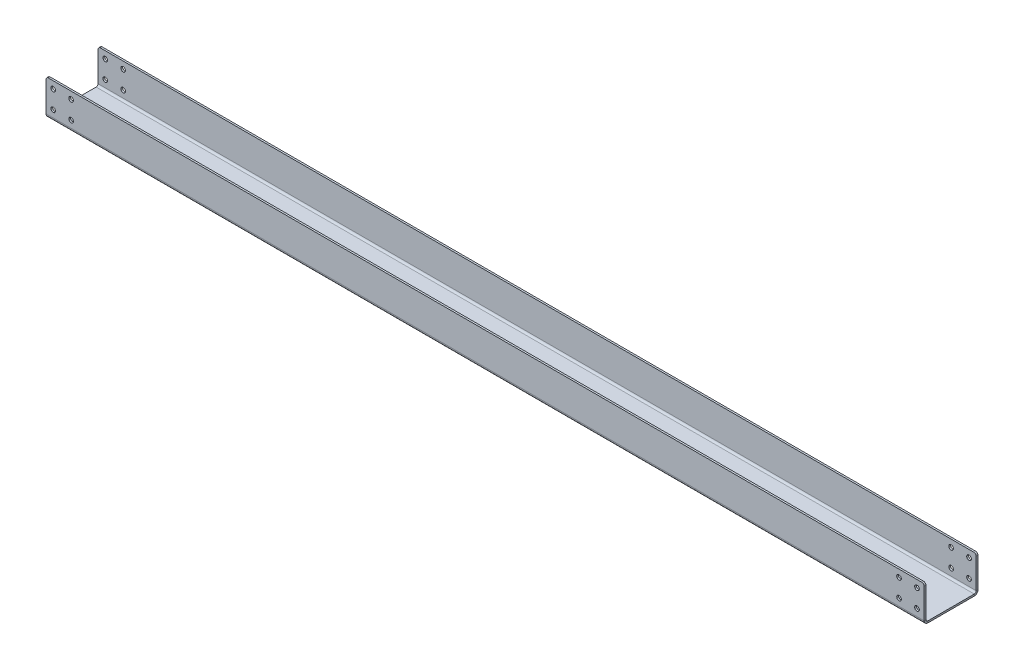
from build123d import *

# Parameters (mm, degrees)
SKETCH1_W                    = 932.18
SKETCH1_H                    = 57.15
BASE_FLANGE1_DEPTH           = 1.89738
EDGE_FLANGE1_STRIP_W         = 11.65352
EDGE_FLANGE1_STRIP_H         = 1.89738
EDGE_FLANGE1_STRIP_CUT_DEPTH = 932.18
EDGE_FLANGE1_DEPTH           = 932.18
EDGE_FLANGE2_STRIP_W         = 11.65352
EDGE_FLANGE2_STRIP_H         = 1.89738
EDGE_FLANGE2_STRIP_CUT_DEPTH = 932.18
EDGE_FLANGE2_DEPTH           = 932.18
SKETCH12_R                   = 2.4638
CUT_EXTRUDE1_DEPTH           = 471.97413973
FILLET1_R                    = 2.54


# Sheet-metal steps are written as plain solids
with BuildPart() as part:
    # Sketch1 → Base-Flange1 (new body)
    with BuildSketch(Plane(origin=(0, 0, 0), x_dir=(1, 0, 0), z_dir=(0, 1, 0))):
        Rectangle(SKETCH1_W, SKETCH1_H)
    extrude(amount=-BASE_FLANGE1_DEPTH)

    # Edge-Flange1 strip (across the edge) → Edge-Flange1 strip cut (cut)
    with BuildSketch(Plane(origin=(-466.09, 0, 28.575), x_dir=(0, 0, -1), z_dir=(1, 0, 0))):
        with Locations((-1.89738, -0.94869)):
            Rectangle(EDGE_FLANGE1_STRIP_W, EDGE_FLANGE1_STRIP_H)
    extrude(amount=EDGE_FLANGE1_STRIP_CUT_DEPTH, mode=Mode.SUBTRACT)

    # Edge-Flange1 section (across the edge) → Edge-Flange1 (add)
    with BuildSketch(Plane(origin=(-466.09, 0, 28.575), x_dir=(0, 0, -1), z_dir=(1, 0, 0))):
        with BuildLine():
            Line((0, 2.032), (0, 36.20262))
            Line((0, 36.20262), (1.89738, 36.20262))
            Line((1.89738, 36.20262), (1.89738, 2.032))
            ThreePointArc((1.89738, 2.032), (2.492539021, 0.595159021), (3.92938, 0))
            Line((3.92938, 0), (3.92938, -1.89738))
            ThreePointArc((3.92938, -1.89738), (1.150888756, -0.746491244), (0, 2.032))
        make_face()
    extrude(amount=EDGE_FLANGE1_DEPTH)

    # Edge-Flange2 strip (across the edge) → Edge-Flange2 strip cut (cut)
    with BuildSketch(Plane(origin=(466.09, 0, -28.575), x_dir=(0, 0, 1), z_dir=(-1, 0, 0))):
        with Locations((-1.89738, -0.94869)):
            Rectangle(EDGE_FLANGE2_STRIP_W, EDGE_FLANGE2_STRIP_H)
    extrude(amount=EDGE_FLANGE2_STRIP_CUT_DEPTH, mode=Mode.SUBTRACT)

    # Edge-Flange2 section (across the edge) → Edge-Flange2 (add)
    with BuildSketch(Plane(origin=(466.09, 0, -28.575), x_dir=(0, 0, 1), z_dir=(-1, 0, 0))):
        with BuildLine():
            Line((0, 2.032), (0, 36.20262))
            Line((0, 36.20262), (1.89738, 36.20262))
            Line((1.89738, 36.20262), (1.89738, 2.032))
            ThreePointArc((1.89738, 2.032), (2.492539021, 0.595159021), (3.92938, 0))
            Line((3.92938, 0), (3.92938, -1.89738))
            ThreePointArc((3.92938, -1.89738), (1.150888756, -0.746491244), (0, 2.032))
        make_face()
    extrude(amount=EDGE_FLANGE2_DEPTH)

    # Sketch12 → Cut-Extrude1 (cut, through all)
    with BuildSketch(Plane.XY.offset(28.575)):
        with Locations((-458.47, 28.58262)):
            Circle(SKETCH12_R)
        with Locations((-458.47, 9.53262)):
            Circle(SKETCH12_R)
        with Locations((-439.42, 28.58262)):
            Circle(SKETCH12_R)
        with Locations((-439.42, 9.53262)):
            Circle(SKETCH12_R)
    cut_extrude1 = extrude(amount=-CUT_EXTRUDE1_DEPTH, mode=Mode.SUBTRACT)

    # Mirror1: Cut-Extrude1 across plane
    add(cut_extrude1.mirror(Plane(origin=(0, 0, 0), x_dir=(0, 0, 1), z_dir=(1, 0, 0))), mode=Mode.SUBTRACT)

    # Fillet1
    fillet1_edges = [part.edges().sort_by_distance(p)[0] for p in [
        (-466.09, 36.20262, 27.62631),
        (466.09, 36.20262, 27.62631),
        (466.09, 36.20262, -27.62631),
        (-466.09, 36.20262, -27.62631),
    ]]
    fillet(fillet1_edges, radius=FILLET1_R)


solid = part.part
